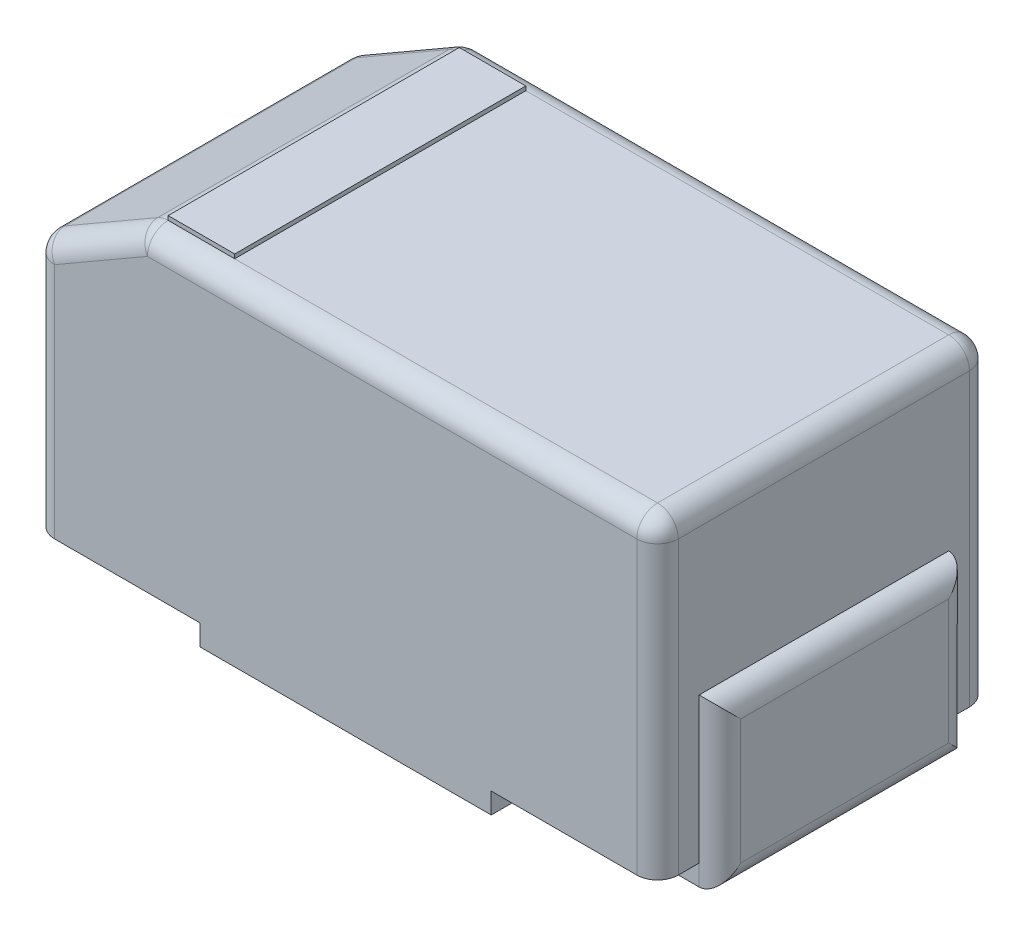
from build123d import *

# Parameters (mm, degrees)
SKETCH_1_W             = 3
SKETCH_1_H             = 1.6
EXTRUDE_1_DEPTH        = 1.6
SKETCH_3_W             = 0.8
SKETCH_3_H             = 1.6
EXTRUDE_2_DEPTH        = 0.1
EXTRUDE_3_DEPTH        = 0.6
EXTRUDE_3_DEPTH_BACK   = 0.6
EXTRUDE_3_2_DEPTH      = 0.6
EXTRUDE_3_2_DEPTH_BACK = 0.6
CHAMFER_1_SIZE         = 0.3
CHAMFER_1_SIZE2        = 0.519615242
FILLET_1_R             = 0.1
SKETCH_7_W             = 0.32
SKETCH_7_H             = 1.4
EXTRUDE_4_DEPTH        = 0.02
FILLET_2_R             = 0.1
FILLET_3_R             = 0.1


with BuildPart() as part:
    # Эскиз1 → Бобышка-Вытянуть1 (new body)
    with BuildSketch(Plane(origin=(0, 0, 0), x_dir=(1, 0, 0), z_dir=(0, 1, 0))):
        Rectangle(SKETCH_1_W, SKETCH_1_H)
    extrude(amount=EXTRUDE_1_DEPTH)


with BuildPart() as body_2:
    # Эскиз3 → Бобышка-Вытянуть2 (new body)
    with BuildSketch(Plane.XZ):
        with Locations((-1.1, 0)):
            Rectangle(SKETCH_3_W, SKETCH_3_H)
    extrude(amount=-EXTRUDE_2_DEPTH)


with BuildPart() as body_3:
    # Зеркальное отражение1: mirrored copy
    add(body_2.part.mirror(Plane(origin=(0, 0, 0), x_dir=(0, 0, 1), z_dir=(1, 0, 0))))


with BuildPart() as part_1:
    add(part.part)

    # Combine 1: cut body 2, body 3
    add(body_2.part, mode=Mode.SUBTRACT)
    add(body_3.part, mode=Mode.SUBTRACT)

    # Фаска1
    chamfer_1_edges = [part_1.edges().sort_by_distance(p)[0] for p in [
        (-1.5, 1.6, 0),
    ]]
    chamfer_1_side = [part_1.faces().sort_by_distance(p)[0] for p in [
        (-1.5, 0.85, 0),
    ]]
    chamfer(chamfer_1_edges, length=CHAMFER_1_SIZE, length2=CHAMFER_1_SIZE2, reference=chamfer_1_side[0])

    # Скругление1
    fillet_1_edges = [part_1.edges().sort_by_distance(p)[0] for p in [
        (0.259807621, 1.6, 0.8),
        (1.5, 1.6, 0),
        (-0.980384758, 1.6, 0),
        (-1.5, 0.7, 0.8),
        (-1.240192379, 1.45, 0.8),
        (-1.5, 0.7, -0.8),
        (-1.5, 1.3, 0),
        (-1.240192379, 1.45, -0.8),
        (0.259807621, 1.6, -0.8),
        (1.5, 0.85, 0.8),
        (1.5, 0.85, -0.8),
    ]]
    fillet(fillet_1_edges, radius=FILLET_1_R)


with BuildPart() as body_2_2:
    # Эскиз5 → Бобышка-Вытянуть3 (new, two sides: drawn at the far end of the back side and taken through both)
    with BuildSketch(Plane.XY.offset(-EXTRUDE_3_DEPTH_BACK)):
        Polygon((-0.7, 0.1), (-1.5, 0.1), (-1.5, 0.8), (-1.6, 0.8), (-1.6, 0), (-0.7, 0), align=None)
    extrude(amount=EXTRUDE_3_DEPTH + EXTRUDE_3_DEPTH_BACK)

    # Скругление3
    fillet_3_edges = [body_2_2.edges().sort_by_distance(p)[0] for p in [
        (-1.6, 0, 0),
        (-1.6, 0.4, 0.6),
        (-1.6, 0.8, 0),
        (-1.6, 0.4, -0.6),
    ]]
    fillet(fillet_3_edges, radius=FILLET_3_R - 0.0001)  # a hair under: the kernel refuses the full size


with BuildPart() as body_3_2:
    # Эскиз5 → Extrude 3 2 (new, two sides: drawn at the far end of the back side and taken through both)
    with BuildSketch(Plane.XY.offset(-EXTRUDE_3_2_DEPTH_BACK)):
        Polygon((1.5, 0.1), (1.5, 0.8), (1.6, 0.8), (1.6, 0), (0.7, 0), (0.7, 0.1), align=None)
    extrude(amount=EXTRUDE_3_2_DEPTH + EXTRUDE_3_2_DEPTH_BACK)

    # Скругление2
    fillet_2_edges = [body_3_2.edges().sort_by_distance(p)[0] for p in [
        (1.6, 0.4, -0.6),
        (1.6, 0, 0),
        (1.6, 0.4, 0.6),
        (1.6, 0.8, 0),
    ]]
    fillet(fillet_2_edges, radius=FILLET_2_R - 0.0001)  # a hair under: the kernel refuses the full size


with BuildPart() as body_4:
    # Эскиз7 → Бобышка-Вытянуть4 (new body)
    with BuildSketch(Plane(origin=(0, 1.6, 0), x_dir=(1, 0, 0), z_dir=(0, 1, 0))):
        with Locations((-0.793589838, 0)):
            Rectangle(SKETCH_7_W, SKETCH_7_H)
    extrude(amount=EXTRUDE_4_DEPTH)


solid = Compound([part_1.part, body_2_2.part, body_3_2.part, body_4.part])
